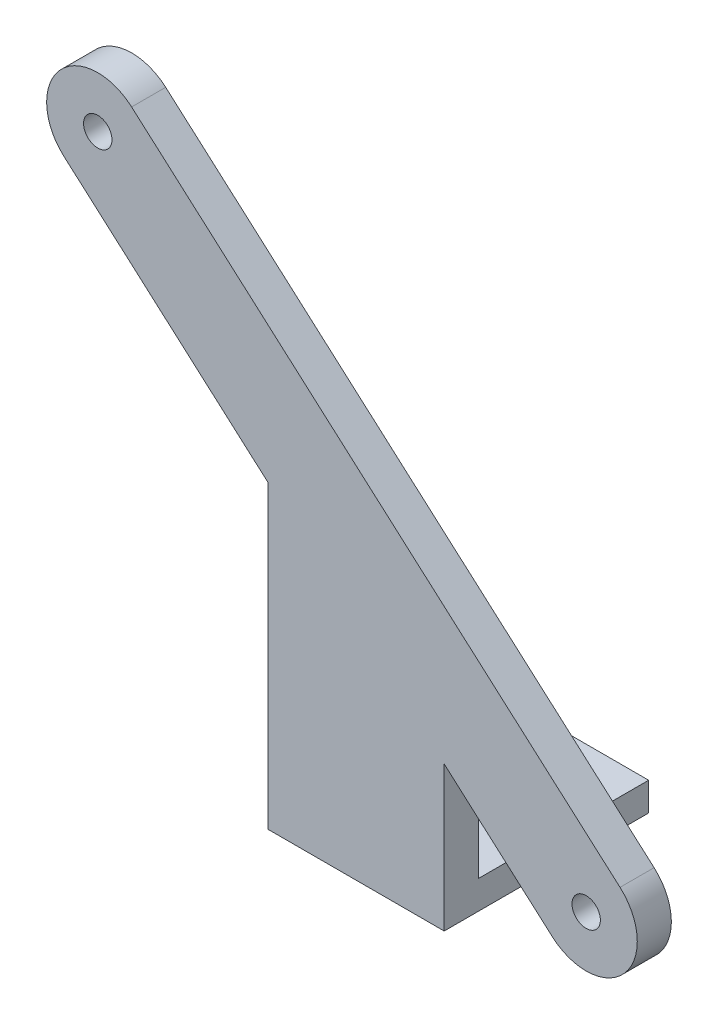
from build123d import *

# Parameters (mm, degrees)
SKETCH1_R            = 1.25
BOSS_EXTRUDE1_DEPTH  = 3
SKETCH2_W            = 18
SKETCH2_H            = 2.5
BOSS_EXTRUDE2_DEPTH  = 15
MOVE_START           = -15
MOVE_FACE1_DEPTH     = 18
M3_CLEARANCE_HOLE1_D = 3.4


# Read off the part's stored shape, not the designer's step: Move Face1
with BuildPart() as part:
    # Sketch1 → Boss-Extrude1 (new body)
    with BuildSketch(Plane.XY):
        with BuildLine():
            Line((24.479890084, 11.071980885), (-18.520109916, 49.071980885))
            ThreePointArc((-18.520109916, 49.071980885), (-24.871980885, 48.679890084), (-24.479890084, 42.328019115))
            Line((-24.479890084, 42.328019115), (-9, 28.64811625))
            Line((-9, 28.64811625), (-9, 0))
            Line((-9, 0), (9, 0))
            Line((9, 0), (9, 12.741139506))
            Line((9, 12.741139506), (18.520109916, 4.328019115))
            ThreePointArc((18.520109916, 4.328019115), (24.871980885, 4.720109916), (24.479890084, 11.071980885))
        make_face()
        with Locations((21.5, 7.7)):
            Circle(SKETCH1_R, mode=Mode.SUBTRACT)
        with Locations((-21.5, 45.7)):
            Circle(SKETCH1_R, mode=Mode.SUBTRACT)
    extrude(amount=BOSS_EXTRUDE1_DEPTH)

    # Sketch2 → Boss-Extrude2 (add)
    with BuildSketch(Plane(origin=(0, 0, 0), x_dir=(-1, 0, 0), z_dir=(0, 0, -1))):
        with Locations((0, 1.25)):
            Rectangle(SKETCH2_W, SKETCH2_H)
    extrude(amount=BOSS_EXTRUDE2_DEPTH)

    # Move Face1 outline → Move Face1 (cut)
    with BuildSketch(Plane.XY.offset(MOVE_START)):
        Polygon((-6.5, 26.438813925), (-9, 28.64811625), (-9, 0), (-6.5, 0), align=None)
    extrude(amount=MOVE_FACE1_DEPTH, mode=Mode.SUBTRACT)

    # M3 Clearance Hole1 (through all)
    with Locations(Plane(origin=(0, 2.5, 0), x_dir=(1, 0, 0), z_dir=(0, 1, 0))):
        with Locations((-2.285533906, 3.964466094), (4.785533906, 11.035533906)):
            Hole(M3_CLEARANCE_HOLE1_D / 2)


solid = part.part
